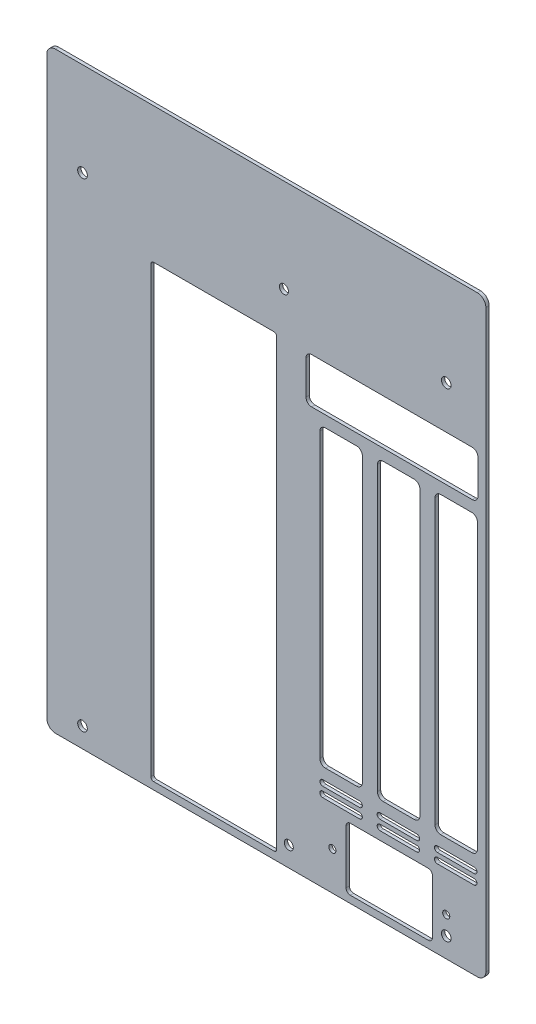
from build123d import *

# Parameters (mm, degrees)
SKETCH1_W                          = 155
SKETCH1_H                          = 209.16
BACKPLATE_DEPTH                    = 1.016
IO_SHIELD_CUTOUT_REACH             = 262.334
SKETCH2_W                          = 44.45
SKETCH2_H                          = 158.75
FILLET1_R                          = 0.99
EXPANSION_CARD_CUTOUT_REACH        = 262.334
SKETCH5_W                          = 15
SKETCH5_H                          = 104
SKETCH5_W_2                        = 60.69
SKETCH5_H_2                        = 16
CONVERT_SOLID2_START               = -0.1524
CONVERT_SOLID2_OUTLINE_W           = 155
CONVERT_SOLID2_OUTLINE_H           = 209.16
CONVERT_SOLID2_OUTLINE_W_2         = 15
CONVERT_SOLID2_OUTLINE_H_2         = 104
CONVERT_SOLID2_OUTLINE_W_3         = 60.69
CONVERT_SOLID2_OUTLINE_H_3         = 16
CONVERT_SOLID2_DEPTH               = 0.1524
FILLET2_R                          = 3.048
EXPANSION_CARD_TABS_REACH          = 262.335
SKETCH33_W                         = 15
SKETCH33_H                         = 2
LPATTERN1_COUNT                    = 3
LPATTERN1_PITCH                    = 20.23
M3_CLEARANCE_HOLE_FRAME_MOUNTING_D = 3.4
PANEL_MOUNT_CABLE_CUTOUT_REACH     = 262.335
SKETCH42_W                         = 30.5
SKETCH42_H                         = 22
FILLET3_R                          = 1.5
TAP_DRILL_FOR_M3X0_5_TAP1_D        = 2.5
FILLET4_R                          = 2
FILLET5_R                          = 1
SPINE_MOUNTING_HOLES_D             = 3.2
SPINE_MOUNTING_HOLES_DEPTH         = 5
SPINE_MOUNTING_HOLES_TIP           = 0.96137699


# Read off the part's stored shape, not the designer's step: Convert-Solid2
with BuildPart() as part:
    # Sketch1 → backplate (new body)
    with BuildSketch(Plane.XY):
        with Locations((77.5, 104.58)):
            Rectangle(SKETCH1_W, SKETCH1_H)
    extrude(amount=BACKPLATE_DEPTH)

    # Sketch2 → io_shield_cutout (cut, up to next)
    with BuildSketch(Plane.XY.offset(1.016), mode=Mode.PRIVATE) as io_shield_cutout_sk1:
        with Locations((58.945, 81.955)):
            Rectangle(SKETCH2_W, SKETCH2_H)
    io_shield_cutout_tool1 = extrude(io_shield_cutout_sk1.sketch, amount=-IO_SHIELD_CUTOUT_REACH, mode=Mode.PRIVATE) & part.part
    add(io_shield_cutout_tool1.solids().sort_by_distance((58.945, 81.955, 1.016))[0], mode=Mode.SUBTRACT)

    # Fillet1
    fillet1_edges = [part.edges().sort_by_distance(p)[0] for p in [
        (36.72, 2.58, 0.508),
        (36.72, 161.33, 0.508),
        (81.17, 161.33, 0.508),
        (81.17, 2.58, 0.508),
    ]]
    fillet(fillet1_edges, radius=FILLET1_R)

    # Sketch5 → expansion-card-cutout (cut, up to next)
    with BuildSketch(Plane.XY.offset(1.016), mode=Mode.PRIVATE) as expansion_card_cutout_sk1:
        with Locations((103.88, 89)):
            Rectangle(SKETCH5_W, SKETCH5_H)
    expansion_card_cutout_tool1 = extrude(expansion_card_cutout_sk1.sketch, amount=-EXPANSION_CARD_CUTOUT_REACH, mode=Mode.PRIVATE) & part.part
    # Sketch5 → expansion-card-cutout (cut, up to next)
    with BuildSketch(Plane.XY.offset(1.016), mode=Mode.PRIVATE) as expansion_card_cutout_sk2:
        with Locations((121.835, 153)):
            Rectangle(SKETCH5_W_2, SKETCH5_H_2)
    expansion_card_cutout_tool2 = extrude(expansion_card_cutout_sk2.sketch, amount=-EXPANSION_CARD_CUTOUT_REACH, mode=Mode.PRIVATE) & part.part
    # Sketch5 → expansion-card-cutout (cut, up to next)
    with BuildSketch(Plane.XY.offset(1.016), mode=Mode.PRIVATE) as expansion_card_cutout_sk3:
        with Locations((124.2, 89)):
            Rectangle(SKETCH5_W, SKETCH5_H)
    expansion_card_cutout_tool3 = extrude(expansion_card_cutout_sk3.sketch, amount=-EXPANSION_CARD_CUTOUT_REACH, mode=Mode.PRIVATE) & part.part
    # Sketch5 → expansion-card-cutout (cut, up to next)
    with BuildSketch(Plane.XY.offset(1.016), mode=Mode.PRIVATE) as expansion_card_cutout_sk4:
        with Locations((144.52, 89)):
            Rectangle(SKETCH5_W, SKETCH5_H)
    expansion_card_cutout_tool4 = extrude(expansion_card_cutout_sk4.sketch, amount=-EXPANSION_CARD_CUTOUT_REACH, mode=Mode.PRIVATE) & part.part
    add(expansion_card_cutout_tool1.solids().sort_by_distance((103.88, 89, 1.016))[0], mode=Mode.SUBTRACT)
    add(expansion_card_cutout_tool2.solids().sort_by_distance((121.835, 153, 1.016))[0], mode=Mode.SUBTRACT)
    add(expansion_card_cutout_tool3.solids().sort_by_distance((124.2, 89, 1.016))[0], mode=Mode.SUBTRACT)
    add(expansion_card_cutout_tool4.solids().sort_by_distance((144.52, 89, 1.016))[0], mode=Mode.SUBTRACT)

    # Convert-Solid2 outline → Convert-Solid2 (add)
    with BuildSketch(Plane.XY.offset(CONVERT_SOLID2_START)):
        with Locations((77.5, 104.58)):
            Rectangle(CONVERT_SOLID2_OUTLINE_W, CONVERT_SOLID2_OUTLINE_H)
        with BuildLine():
            ThreePointArc((37.71, 2.58), (37.009964287, 2.869964287), (36.72, 3.57))
            Line((36.72, 3.57), (36.72, 160.34))
            ThreePointArc((36.72, 160.34), (37.009964287, 161.040035713), (37.71, 161.33))
            Line((37.71, 161.33), (80.18, 161.33))
            ThreePointArc((80.18, 161.33), (80.880035713, 161.040035713), (81.17, 160.34))
            Line((81.17, 160.34), (81.17, 3.57))
            ThreePointArc((81.17, 3.57), (80.880035713, 2.869964287), (80.18, 2.58))
            Line((80.18, 2.58), (37.71, 2.58))
        make_face(mode=Mode.SUBTRACT)
        with Locations((103.88, 89)):
            Rectangle(CONVERT_SOLID2_OUTLINE_W_2, CONVERT_SOLID2_OUTLINE_H_2, mode=Mode.SUBTRACT)
        with Locations((124.2, 89)):
            Rectangle(CONVERT_SOLID2_OUTLINE_W_2, CONVERT_SOLID2_OUTLINE_H_2, mode=Mode.SUBTRACT)
        with Locations((144.52, 89)):
            Rectangle(CONVERT_SOLID2_OUTLINE_W_2, CONVERT_SOLID2_OUTLINE_H_2, mode=Mode.SUBTRACT)
        with Locations((121.835, 153)):
            Rectangle(CONVERT_SOLID2_OUTLINE_W_3, CONVERT_SOLID2_OUTLINE_H_3, mode=Mode.SUBTRACT)
    extrude(amount=CONVERT_SOLID2_DEPTH)

    # Fillet2
    fillet2_edges = [part.edges().sort_by_distance(p)[0] for p in [
        (0, 0, 0.4318),
        (0, 209.16, 0.4318),
        (155, 209.16, 0.4318),
        (155, 0, 0.4318),
    ]]
    fillet(fillet2_edges, radius=FILLET2_R)

    # Sketch33 → expansion-card-tabs (cut, up to next)
    with BuildSketch(Plane.XY.offset(1.016), mode=Mode.PRIVATE) as expansion_card_tabs_sk1:
        with Locations((103.88, 32)):
            Rectangle(SKETCH33_W, SKETCH33_H)
    expansion_card_tabs_tool1 = extrude(expansion_card_tabs_sk1.sketch, amount=-EXPANSION_CARD_TABS_REACH, mode=Mode.PRIVATE) & part.part
    # Sketch33 → expansion-card-tabs (cut, up to next)
    with BuildSketch(Plane.XY.offset(1.016), mode=Mode.PRIVATE) as expansion_card_tabs_sk2:
        with Locations((103.88, 28.5)):
            Rectangle(SKETCH33_W, SKETCH33_H)
    expansion_card_tabs_tool2 = extrude(expansion_card_tabs_sk2.sketch, amount=-EXPANSION_CARD_TABS_REACH, mode=Mode.PRIVATE) & part.part
    expansion_card_tabs_1 = expansion_card_tabs_tool1.solids().sort_by_distance((103.88, 32, 1.016))[0]
    add(expansion_card_tabs_1, mode=Mode.SUBTRACT)
    expansion_card_tabs_2 = expansion_card_tabs_tool2.solids().sort_by_distance((103.88, 28.5, 1.016))[0]
    add(expansion_card_tabs_2, mode=Mode.SUBTRACT)
    expansion_card_tabs = expansion_card_tabs_1 + expansion_card_tabs_2  # expansion-card-tabs as one shape, for the pattern or mirror that repeats it

    # LPattern1: expansion-card-tabs ×3
    with Locations(*[(i * LPATTERN1_PITCH, 0, 0) for i in range(1, LPATTERN1_COUNT)]):
        add(expansion_card_tabs, mode=Mode.SUBTRACT)

    # M3 Clearance Hole frame mounting (through all)
    with Locations(Plane(origin=(0, 0, -0.1524), x_dir=(-1, 0, 0), z_dir=(0, 0, -1))):
        with Locations((-12.6, 7.025), (-141, 176.135), (-141, 7.025), (-12.6, 176.135)):
            Hole(M3_CLEARANCE_HOLE_FRAME_MOUNTING_D / 2)

    # Sketch42 → panel-mount-cable-cutout (cut, up to next)
    with BuildSketch(Plane.XY.offset(1.016), mode=Mode.PRIVATE) as panel_mount_cable_cutout_sk1:
        with Locations((120.9, 13.54)):
            Rectangle(SKETCH42_W, SKETCH42_H)
    panel_mount_cable_cutout_tool1 = extrude(panel_mount_cable_cutout_sk1.sketch, amount=-PANEL_MOUNT_CABLE_CUTOUT_REACH, mode=Mode.PRIVATE) & part.part
    add(panel_mount_cable_cutout_tool1.solids().sort_by_distance((120.9, 13.54, 1.016))[0], mode=Mode.SUBTRACT)

    # Fillet3
    fillet3_edges = [part.edges().sort_by_distance(p)[0] for p in [
        (105.65, 2.54, 0.4318),
        (105.65, 24.54, 0.4318),
        (136.15, 24.54, 0.4318),
        (136.15, 2.54, 0.4318),
    ]]
    fillet(fillet3_edges, radius=FILLET3_R)

    # Tap Drill for M3x0.5 Tap1 (through all)
    with Locations(Plane(origin=(100.8, 13.54, 1.016), x_dir=(1, 0, 0), z_dir=(0, 0, 1))):
        with Locations((0, 0), (40.2, 0)):
            Hole(TAP_DRILL_FOR_M3X0_5_TAP1_D / 2)

    # Fillet4
    fillet4_edges = [part.edges().sort_by_distance(p)[0] for p in [
        (91.49, 145, 0.4318),
        (152.18, 145, 0.4318),
        (152.18, 161, 0.4318),
        (91.49, 161, 0.4318),
        (137.02, 37, 0.4318),
        (152.02, 37, 0.4318),
        (152.02, 141, 0.4318),
        (137.02, 141, 0.4318),
        (116.7, 37, 0.4318),
        (131.7, 37, 0.4318),
        (131.7, 141, 0.4318),
        (116.7, 141, 0.4318),
        (96.38, 37, 0.4318),
        (111.38, 37, 0.4318),
        (111.38, 141, 0.4318),
        (96.38, 141, 0.4318),
    ]]
    fillet(fillet4_edges, radius=FILLET4_R)

    # Fillet5
    fillet5_edges = [part.edges().sort_by_distance(p)[0] for p in [
        (116.61, 33, 0.4318),
        (116.61, 31, 0.4318),
        (116.61, 27.5, 0.4318),
        (136.84, 33, 0.4318),
        (136.84, 31, 0.4318),
        (136.84, 27.5, 0.4318),
        (116.61, 29.5, 0.4318),
        (136.84, 29.5, 0.4318),
        (131.61, 27.5, 0.4318),
        (131.61, 29.5, 0.4318),
        (131.61, 33, 0.4318),
        (151.84, 33, 0.4318),
        (151.84, 27.5, 0.4318),
        (151.84, 29.5, 0.4318),
        (151.84, 31, 0.4318),
        (131.61, 31, 0.4318),
        (111.38, 31, 0.4318),
        (111.38, 27.5, 0.4318),
        (111.38, 29.5, 0.4318),
        (96.38, 29.5, 0.4318),
        (96.38, 27.5, 0.4318),
        (96.38, 31, 0.4318),
        (96.38, 33, 0.4318),
        (111.38, 33, 0.4318),
    ]]
    fillet(fillet5_edges, radius=FILLET5_R - 0.0001)  # a hair under: the kernel refuses the full size

    # spine-mounting-holes
    with Locations(Plane.XY.offset(1.016)):
        with Locations((83.71, 176.135), (85.42, 7.025)):
            Hole(SPINE_MOUNTING_HOLES_D / 2, depth=SPINE_MOUNTING_HOLES_DEPTH)
            with Locations((0, 0, -(SPINE_MOUNTING_HOLES_DEPTH + SPINE_MOUNTING_HOLES_TIP / 2))):  # 118° drill point
                Cone(0, SPINE_MOUNTING_HOLES_D / 2, SPINE_MOUNTING_HOLES_TIP, mode=Mode.SUBTRACT)


solid = part.part
